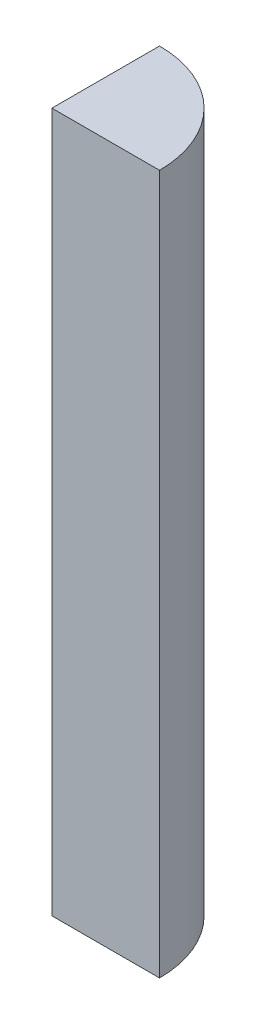
from build123d import *

# Parameters (mm, degrees)
BOSS_EXTRUDE1_DEPTH = 130


with BuildPart() as part:
    # Sketch1 → Boss-Extrude1 (new body)
    with BuildSketch(Plane(origin=(0, 0, 0), x_dir=(1, 0, 0), z_dir=(0, 1, 0))):
        with BuildLine():
            Line((0, 0), (20, 0))
            ThreePointArc((20, 0), (14.142135624, 14.142135624), (0, 20))
            Line((0, 20), (0, 0))
        make_face()
    extrude(amount=BOSS_EXTRUDE1_DEPTH)


solid = part.part
